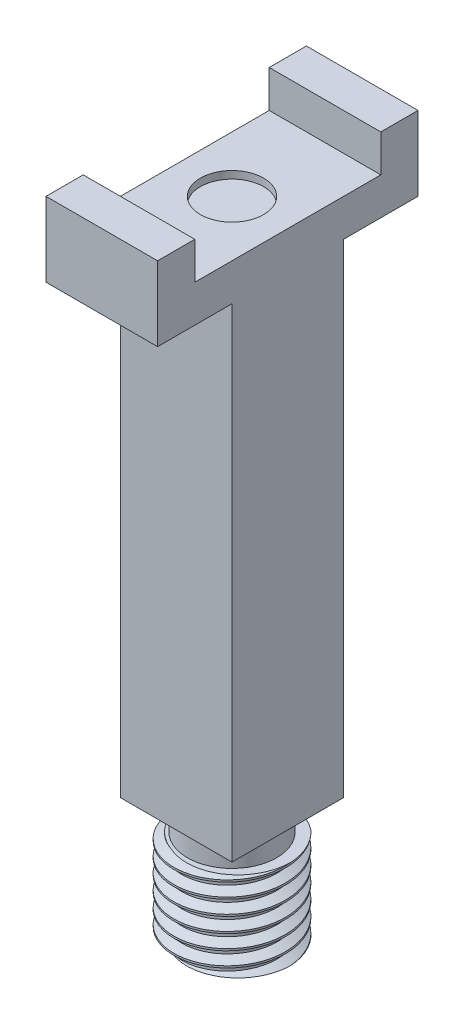
from build123d import *

# Parameters (mm, degrees)
SCHIZZO1_W                   = 15
SCHIZZO1_H                   = 15
ESTRUSIONE_ESTRUSIONE1_DEPTH = 70
SCHIZZO2_W                   = 15
SCHIZZO2_H                   = 5
ESTRUSIONE_ESTRUSIONE2_DEPTH = 10
SCHIZZO3_W                   = 15
SCHIZZO3_H                   = 5
ESTRUSIONE_ESTRUSIONE3_DEPTH = 5
SKETCH1_R                    = 6
BOSS_EXTRUDE1_DEPTH          = 4
SKETCH11_R                   = 7.5
BOSS_EXTRUDE2_DEPTH          = 12
THREAD2_PITCH                = 2
SKETCH12_R                   = 4.25
CUT_EXTRUDE1_DEPTH           = 1


with BuildPart() as part:
    # Schizzo1 → Estrusione-Estrusione1 (new body)
    with BuildSketch(Plane(origin=(0, 0, 0), x_dir=(1, 0, 0), z_dir=(0, 1, 0))):
        Rectangle(SCHIZZO1_W, SCHIZZO1_H)
    extrude(amount=ESTRUSIONE_ESTRUSIONE1_DEPTH)

    # Schizzo2 → Estrusione-Estrusione2 (add)
    with BuildSketch(Plane.XY.offset(7.5)):
        with Locations((0, 67.5)):
            Rectangle(SCHIZZO2_W, SCHIZZO2_H)
    estrusione_estrusione2 = extrude(amount=ESTRUSIONE_ESTRUSIONE2_DEPTH)

    # Schizzo3 → Estrusione-Estrusione3 (add)
    with BuildSketch(Plane(origin=(0, 70, 0), x_dir=(1, 0, 0), z_dir=(0, 1, 0))):
        with Locations((0, -15)):
            Rectangle(SCHIZZO3_W, SCHIZZO3_H)
    estrusione_estrusione3 = extrude(amount=ESTRUSIONE_ESTRUSIONE3_DEPTH)

    # Specchia1: Estrusione-Estrusione2, Estrusione-Estrusione3 across plane
    add(estrusione_estrusione2.mirror(Plane(origin=(0, 0, 0), x_dir=(1, 0, 0), z_dir=(0, 0, -1))))
    add(estrusione_estrusione3.mirror(Plane(origin=(0, 0, 0), x_dir=(1, 0, 0), z_dir=(0, 0, -1))))

    # Sketch1 → Boss-Extrude1 (add)
    with BuildSketch(Plane.XZ):
        with Locations(Location((0, 0, 0), (0, 0, 270))):
            Circle(SKETCH1_R)
    extrude(amount=BOSS_EXTRUDE1_DEPTH)

    # Sketch11 → Boss-Extrude2 (add)
    with BuildSketch(Plane.XZ.offset(4)):
        with Locations(Location((0, 0, 0), (0, 0, 270))):
            Circle(SKETCH11_R)
    extrude(amount=BOSS_EXTRUDE2_DEPTH)

    # Thread2: the profile of Thread Profile2 profile screwed along a right-hand helix of 7.5 turns, 10 arcs to a turn; built about Z, then put on its axis
    thread2_z = Axis((0, 0, 0), (0, 0, 1))
    thread2_corners = [(7.5003, 2e-09, -0.000173205), (7.5003, 2e-09, 1.7501732), (6.41746825, 2e-09, 1.124999997), (6.41746825, 2e-09, 0.624999997)]
    with BuildLine(mode=Mode.PRIVATE) as thread2_profile:
        Line(thread2_corners[0], thread2_corners[1])
        Line(thread2_corners[1], thread2_corners[2])
        Line(thread2_corners[2], thread2_corners[3])
        Line(thread2_corners[3], thread2_corners[0])
    thread2_cap = Face(thread2_profile.wire())
    thread2_turn_angles = [0, 18, 36, 54, 72, 90, 108, 126, 144, 162, 180, 198, 216, 234, 252, 270, 288, 306, 324, 342, 360]
    thread2_turn_weights = [1, 0.9510565162951535, 1, 0.9510565162951535, 1, 0.9510565162951535, 1, 0.9510565162951535, 1, 0.9510565162951535, 1, 0.9510565162951535, 1, 0.9510565162951535, 1, 0.9510565162951535, 1, 0.9510565162951535, 1, 0.9510565162951535, 1]
    thread2_turn_rails = [Edge.make_bspline([Vector(p[0], p[1], 0).rotate(thread2_z, thread2_turn_angles[k]) / thread2_turn_weights[k] + Vector(0, 0, p[2] + THREAD2_PITCH * thread2_turn_angles[k] / 360) for k in range(21)], [0, 0, 0, 1, 1, 2, 2, 3, 3, 4, 4, 5, 5, 6, 6, 7, 7, 8, 8, 9, 9, 10, 10, 10], 2, thread2_turn_weights) for p in thread2_corners]
    thread2_turn_sides = [Face.make_surface_from_curves(thread2_turn_rails[p[0]], thread2_turn_rails[p[1]]) for p in [(0, 1), (1, 2), (2, 3), (3, 0)]]
    thread2_last_angles = [2520, 2538, 2556, 2574, 2592, 2610, 2628, 2646, 2664, 2682, 2700]
    thread2_last_weights = [1, 0.9510565162951535, 1, 0.9510565162951535, 1, 0.9510565162951535, 1, 0.9510565162951535, 1, 0.9510565162951535, 1]
    thread2_last_rails = [Edge.make_bspline([Vector(p[0], p[1], 0).rotate(thread2_z, thread2_last_angles[k]) / thread2_last_weights[k] + Vector(0, 0, p[2] + THREAD2_PITCH * thread2_last_angles[k] / 360) for k in range(11)], [0, 0, 0, 1, 1, 2, 2, 3, 3, 4, 4, 5, 5, 5], 2, thread2_last_weights) for p in thread2_corners]
    thread2_last_sides = [Face.make_surface_from_curves(thread2_last_rails[p[0]], thread2_last_rails[p[1]]) for p in [(0, 1), (1, 2), (2, 3), (3, 0)]]
    thread2 = Plane(origin=(0, -18, 0), x_dir=(0.998629535, 0, -0.052335956), z_dir=(0, 1, 0)) * Solid(Shell([*[p.moved(Location((0, 0, THREAD2_PITCH * i))) for i in range(7) for p in thread2_turn_sides], *thread2_last_sides, thread2_cap, thread2_cap.rotate(thread2_z, 2700).moved(Location((0, 0, THREAD2_PITCH * 2700 / 360)))]))
    add(thread2, mode=Mode.SUBTRACT)

    # Sketch12 → Cut-Extrude1 (cut)
    with BuildSketch(Plane(origin=(0, 70, 0), x_dir=(1, 0, 0), z_dir=(0, 1, 0))):
        with Locations(Location((0, 0, 0), (0, 0, 270))):
            Circle(SKETCH12_R)
    extrude(amount=-CUT_EXTRUDE1_DEPTH, mode=Mode.SUBTRACT)


solid = part.part
